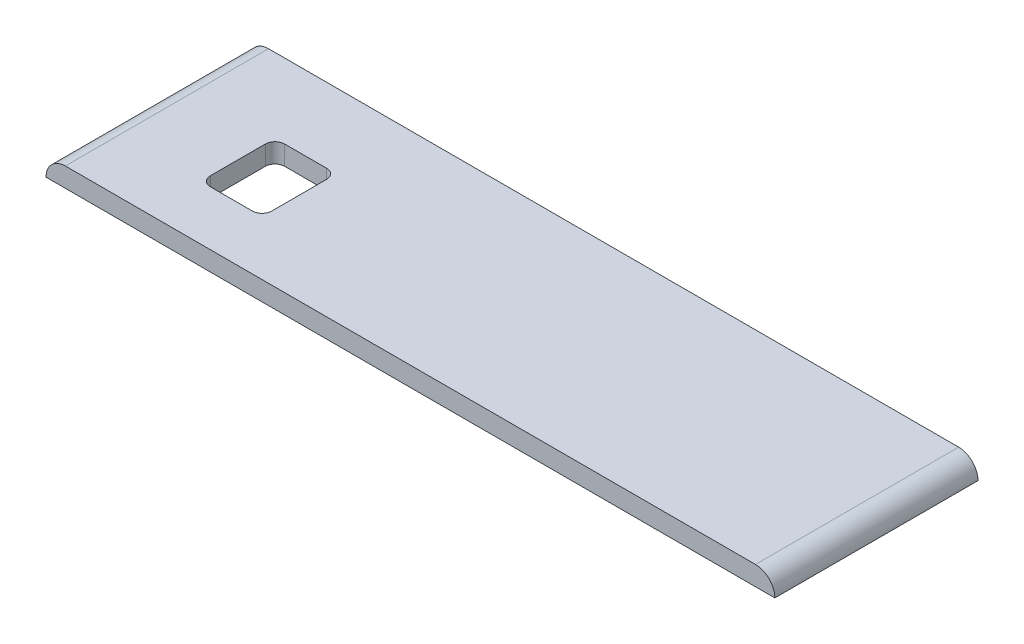
from build123d import *

# Parameters (mm, degrees)
SKETCH_1_W                      = 113
SKETCH_1_H                      = 31.5
SKETCH_1_W_2                    = 9.5
SKETCH_1_H_2                    = 11.5
EXTRUDE_1_DEPTH                 = 3
TOOL_D3_R1P5_POWER_CORNERS_R    = 1.5
TOOL_D3_R3_REAR_OUTER_CORNERS_R = 3


with BuildPart() as part:
    # Эскиз1 → Бобышка-Вытянуть1 (new body)
    with BuildSketch(Plane(origin=(0, 0, 0), x_dir=(1, 0, 0), z_dir=(0, 1, 0))):
        with Locations((53.5, -15.75)):
            Rectangle(SKETCH_1_W, SKETCH_1_H)
        with Locations((17.3, -17.3)):
            Rectangle(SKETCH_1_W_2, SKETCH_1_H_2, mode=Mode.SUBTRACT)
    extrude(amount=EXTRUDE_1_DEPTH)

    # tool_D3_R1p5_power_corners
    tool_d3_r1p5_power_corners_edges = [part.edges().sort_by_distance(p)[0] for p in [
        (12.55, 1.5, 11.55),
        (12.55, 1.5, 23.05),
        (22.05, 1.5, 23.05),
        (22.05, 1.5, 11.55),
    ]]
    fillet(tool_d3_r1p5_power_corners_edges, radius=TOOL_D3_R1P5_POWER_CORNERS_R)

    # tool_D3_R3_rear_outer_corners
    tool_d3_r3_rear_outer_corners_edges = [part.edges().sort_by_distance(p)[0] for p in [
        (-3, 3, 15.75),
        (110, 3, 15.75),
    ]]
    fillet(tool_d3_r3_rear_outer_corners_edges, radius=TOOL_D3_R3_REAR_OUTER_CORNERS_R - 0.0001)  # a hair under: the kernel refuses the full size


solid = part.part
